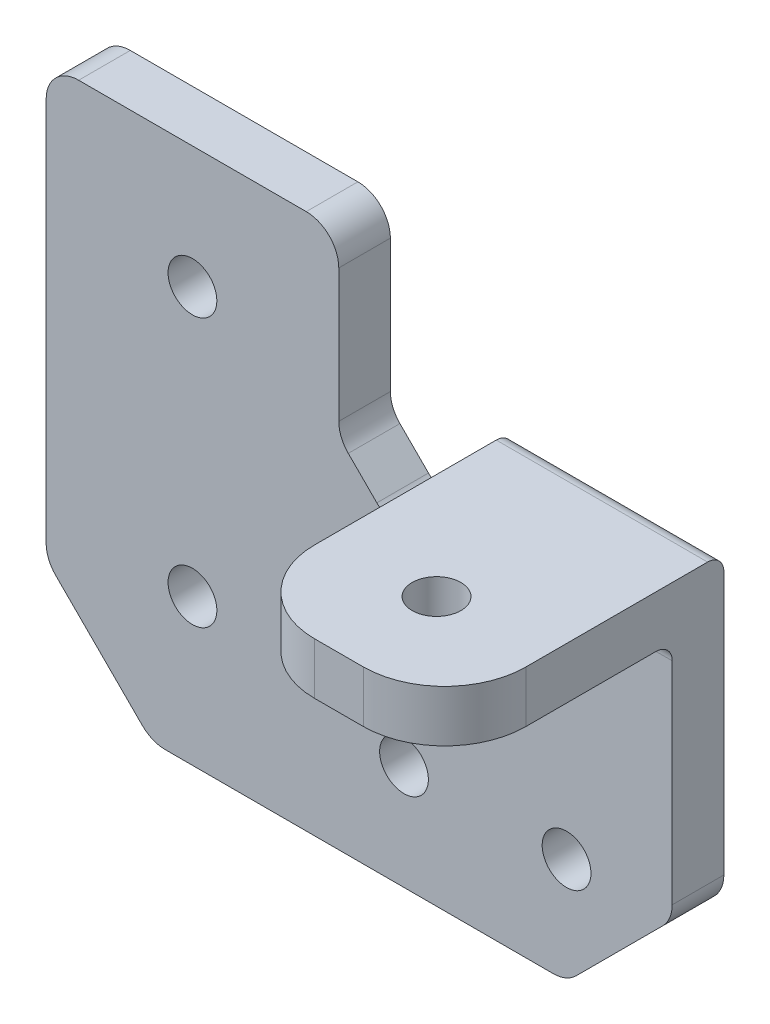
from build123d import *

# Parameters (mm, degrees)
SKETCH1_R               = 6.5
SKETCH1_R_2             = 1.5
BOSS_EXTRUDE1_DEPTH     = 3.175
SKETCH2_W               = 13
SKETCH2_H               = 3.175
BOSS_EXTRUDE2_DEPTH     = 14
SKETCH3_R               = 1.5
CUT_EXTRUDE1_DEPTH      = 18
FILLET1_R               = 5
BOSS_EXTRUDE3_START     = -3.175
BOSS_EXTRUDE3_OUTLINE_R = 1.5
BOSS_EXTRUDE3_DEPTH     = 3.175
FILLET3_R               = 1
BOSS_EXTRUDE4_START     = -3.175
BOSS_EXTRUDE4_DEPTH     = 3.175
SKETCH6_R               = 1.5
CUT_EXTRUDE2_DEPTH      = 3.175
CHAMFER1_SIZE           = 4
FILLET4_R               = 2
CUT_EXTRUDE3_DEPTH      = 10
FILLET5_R               = 2
SKETCH8_R               = 1.5
BOSS_EXTRUDE5_DEPTH     = 3.175
CHAMFER2_SIZE           = 4
FILLET6_R               = 2
SKETCH9_R               = 1.5
CUT_EXTRUDE4_DEPTH      = 10
SKETCH9_3_W             = 16.093211202
SKETCH9_3_H             = 15.71695658
SKETCH9_3_R             = 1.5
SKETCH9_3_W_2           = 4.964902022
SKETCH9_3_H_2           = 7.25050354
BOSS_EXTRUDE6_DEPTH     = 3.175
CHAMFER3_SIZE           = 6.5
FILLET7_R               = 2


# Read off the part's stored shape, not the designer's step: Boss-Extrude3
with BuildPart() as part:
    # Sketch1 → Boss-Extrude1 (new body)
    # profile 1 of 2: a face of its own
    with BuildSketch(Plane.XY):
        Circle(SKETCH1_R)
        Circle(SKETCH1_R_2, mode=Mode.SUBTRACT)
    # profile 2 of 2: a face of its own
    with BuildSketch(Plane.XY):
        with BuildLine():
            Line((-6.5, 18), (-6.5, 0))
            ThreePointArc((-6.5, 0), (0, 6.5), (6.5, 0))
            Line((6.5, 0), (6.5, 18))
            Line((6.5, 18), (-6.5, 18))
        make_face()
    extrude(amount=BOSS_EXTRUDE1_DEPTH)

    # Sketch2 → Boss-Extrude2 (add)
    with BuildSketch(Plane.XY.offset(3.175)):
        with Locations((0, 16.4125)):
            Rectangle(SKETCH2_W, SKETCH2_H)
    extrude(amount=BOSS_EXTRUDE2_DEPTH)

    # Sketch3 → Cut-Extrude1 (cut)
    with BuildSketch(Plane(origin=(0, 18, 0), x_dir=(1, 0, 0), z_dir=(0, 1, 0))):
        with Locations(Location((0, -11.175, 0), (0, 0, 270))):
            Circle(SKETCH3_R)
    extrude(amount=-CUT_EXTRUDE1_DEPTH, mode=Mode.SUBTRACT)

    # Fillet1
    fillet1_edges = [part.edges().sort_by_distance(p)[0] for p in [
        (-6.5, 16.4125, 17.175),
        (6.5, 16.4125, 17.175),
    ]]
    fillet(fillet1_edges, radius=FILLET1_R)

    # Boss-Extrude3 outline → Boss-Extrude3 (add)
    with BuildSketch(Plane(origin=(0, 0, 0), x_dir=(-1, 0, 0), z_dir=(0, 0, -1)).offset(BOSS_EXTRUDE3_START)):
        with BuildLine():
            ThreePointArc((6.5, 0), (4.596194078, -4.596194078), (0, -6.5))
            Line((0, -6.5), (10, -6.5))
            ThreePointArc((10, -6.5), (16.239069091, 1.823188658), (6.5, 5.477225575))
            Line((6.5, 5.477225575), (6.5, 0))
        make_face()
        with Locations((10, 0)):
            Circle(BOSS_EXTRUDE3_OUTLINE_R, mode=Mode.SUBTRACT)
    extrude(amount=BOSS_EXTRUDE3_DEPTH)

    # Fillet3
    fillet3_edges = [part.edges().sort_by_distance(p)[0] for p in [
        (0, 14.825, 3.175),
        (0, 18, 0),
    ]]
    fillet(fillet3_edges, radius=FILLET3_R)

    # Sketch5 → Boss-Extrude4 (add)
    with BuildSketch(Plane(origin=(0, 0, 0), x_dir=(-1, 0, 0), z_dir=(0, 0, -1)).offset(BOSS_EXTRUDE4_START)):
        with BuildLine():
            Line((32.012922913, -6.5), (32.012922913, 11.5))
            Line((32.012922913, 11.5), (6.5, 11.5))
            Line((6.5, 11.5), (6.5, 5.477225575))
            ThreePointArc((6.5, 5.477225575), (16.239069091, 1.823188658), (10, -6.5))
            Line((10, -6.5), (32.012922913, -6.5))
        make_face()
    extrude(amount=BOSS_EXTRUDE4_DEPTH)

    # Sketch6 → Cut-Extrude2 (cut)
    with BuildSketch(Plane(origin=(0, 0, 0), x_dir=(-1, 0, 0), z_dir=(0, 0, -1))):
        with Locations((18.012922913, -2.5)):
            Circle(SKETCH6_R)
        with Locations((28.012922913, -2.5)):
            Circle(SKETCH6_R)
        with Locations((18.012922913, 7.5)):
            Circle(SKETCH6_R)
        with Locations((28.012922913, 7.5)):
            Circle(SKETCH6_R)
        with Locations((23.012922913, 2.5)):
            Circle(SKETCH6_R)
    extrude(amount=-CUT_EXTRUDE2_DEPTH, mode=Mode.SUBTRACT)

    # Chamfer1
    # the kernel refuses this chamfer: 4 mm, written as the material it adds along each edge
    with BuildSketch(Plane(origin=(-6.5, 11.5, 3.175), x_dir=(0.027495876610586053, 0.9996219169112968, 0), z_dir=(0, 0, -1))) as chamfer1_piece_1:
        Polygon((CHAMFER1_SIZE * 0.999621916911, -CHAMFER1_SIZE * 0.0274958766106), (-CHAMFER1_SIZE * 0.0274958766106, -CHAMFER1_SIZE * 0.999621916911), (0, 0), align=None)
    extrude(amount=3.175)

    # Fillet4
    fillet4_edges = [part.edges().sort_by_distance(p)[0] for p in [
        (-32.012922913, 11.5, 1.5875),
        (-32.012922913, -6.5, 1.5875),
    ]]
    fillet(fillet4_edges, radius=FILLET4_R)

    # Sketch7 → Cut-Extrude3 (cut)
    with BuildSketch(Plane(origin=(0, 0, 0), x_dir=(-1, 0, 0), z_dir=(0, 0, -1))):
        Polygon((-6.5, 0), (0, -6.5), (-6.5, -6.5), align=None)
    extrude(amount=-CUT_EXTRUDE3_DEPTH, mode=Mode.SUBTRACT)

    # Fillet5
    fillet5_edges = [part.edges().sort_by_distance(p)[0] for p in [
        (6.5, 0, 1.5875),
        (-10.5, 11.5, 1.5875),
        (-6.5, 15.5, 1.5875),
        (0, -6.5, 1.5875),
    ]]
    fillet(fillet5_edges, radius=FILLET5_R)

    # Sketch8 → Boss-Extrude5 (add)
    # profile 1 of 4: a face of its own
    with BuildSketch(Plane(origin=(0, 0, 0), x_dir=(-1, 0, 0), z_dir=(0, 0, -1))):
        with BuildLine():
            Line((14.012922913, 11.5), (14.012922913, -6.5))
            Line((14.012922913, -6.5), (30.012922913, -6.5))
            ThreePointArc((30.012922913, -6.5), (31.427136475, -5.914213562), (32.012922913, -4.5))
            Line((32.012922913, -4.5), (32.012922913, 9.5))
            ThreePointArc((32.012922913, 9.5), (31.427136475, 10.914213562), (30.012922913, 11.5))
            Line((30.012922913, 11.5), (14.012922913, 11.5))
        make_face()
        with Locations((18.012922913, -2.5)):
            Circle(SKETCH8_R, mode=Mode.SUBTRACT)
        with Locations((18.012922913, 7.5)):
            Circle(SKETCH8_R, mode=Mode.SUBTRACT)
        with Locations((23.012922913, 2.5)):
            Circle(SKETCH8_R, mode=Mode.SUBTRACT)
        with Locations((28.012922913, -2.5)):
            Circle(SKETCH8_R, mode=Mode.SUBTRACT)
        with Locations((28.012922913, 7.5)):
            Circle(SKETCH8_R, mode=Mode.SUBTRACT)
    # profile 2 of 4: a face of its own
    with BuildSketch(Plane(origin=(0, 0, 0), x_dir=(-1, 0, 0), z_dir=(0, 0, -1))):
        Polygon((14.012922913, 26.5), (14.012922913, 11.5), (30.012922913, 11.5), (32.012922913, 11.5), (32.012922913, 26.5), align=None)
    # profile 3 of 4: a face of its own
    with BuildSketch(Plane(origin=(0, 0, 0), x_dir=(-1, 0, 0), z_dir=(0, 0, -1))):
        with BuildLine():
            Line((32.012922913, 11.5), (30.012922913, 11.5))
            ThreePointArc((30.012922913, 11.5), (31.427136475, 10.914213562), (32.012922913, 9.5))
            Line((32.012922913, 9.5), (32.012922913, 11.5))
        make_face()
    # profile 4 of 4: a face of its own
    with BuildSketch(Plane(origin=(0, 0, 0), x_dir=(-1, 0, 0), z_dir=(0, 0, -1))):
        with BuildLine():
            ThreePointArc((32.012922913, -4.5), (31.427136475, -5.914213562), (30.012922913, -6.5))
            Line((30.012922913, -6.5), (32.012922913, -6.5))
            Line((32.012922913, -6.5), (32.012922913, -4.5))
        make_face()
    extrude(amount=-BOSS_EXTRUDE5_DEPTH)

    # Chamfer2
    # the kernel refuses this chamfer: 4 mm, written as the material it adds along each edge
    with BuildSketch(Plane(origin=(-14.012922913, 11.5, 0), x_dir=(-0.027495876610586053, 0.9996219169112968, 0), z_dir=(0, 0, 1))) as chamfer2_piece_1:
        Polygon((CHAMFER2_SIZE * 0.999621916911, -CHAMFER2_SIZE * 0.0274958766106), (-CHAMFER2_SIZE * 0.0274958766106, -CHAMFER2_SIZE * 0.999621916911), (0, 0), align=None)
    extrude(amount=3.175)

    # Fillet6
    fillet6_edges = [part.edges().sort_by_distance(p)[0] for p in [
        (-32.012922913, 26.5, 1.5875),
        (-14.012922913, 26.5, 1.5875),
        (-14.012922913, 15.5, 1.5875),
        (-10.298499236, 11.785576323, 1.5875),
    ]]
    fillet(fillet6_edges, radius=FILLET6_R)

    # Sketch9 → Cut-Extrude4 (cut)
    with BuildSketch(Plane(origin=(0, 0, 0), x_dir=(-1, 0, 0), z_dir=(0, 0, -1))):
        with Locations((23.012922913, 19)):
            Circle(SKETCH9_R)
    extrude(amount=-CUT_EXTRUDE4_DEPTH, mode=Mode.SUBTRACT)

    # Sketch9<3> → Boss-Extrude6 (add)
    # profile 1 of 5: a face of its own
    with BuildSketch(Plane(origin=(0, 0, 0), x_dir=(-1, 0, 0), z_dir=(0, 0, -1))):
        with Locations((23.012922913, 2.5)):
            Rectangle(SKETCH9_3_W, SKETCH9_3_H)
        with Locations((28.012922913, -2.5)):
            Circle(SKETCH9_3_R, mode=Mode.SUBTRACT)
        with Locations((18.012922913, 7.5)):
            Circle(SKETCH9_3_R, mode=Mode.SUBTRACT)
        with Locations((18.012922913, -2.5)):
            Circle(SKETCH9_3_R, mode=Mode.SUBTRACT)
        with Locations((28.012922913, 7.5)):
            Circle(SKETCH9_3_R, mode=Mode.SUBTRACT)
        with Locations((23.012922913, 2.5)):
            Rectangle(SKETCH9_3_W_2, SKETCH9_3_H_2, mode=Mode.SUBTRACT)
    # profile 2 of 5: a face of its own
    with BuildSketch(Plane(origin=(0, 0, 0), x_dir=(-1, 0, 0), z_dir=(0, 0, -1))):
        with Locations((28.012922913, -2.5)):
            Circle(SKETCH9_3_R)
    # profile 3 of 5: a face of its own
    with BuildSketch(Plane(origin=(0, 0, 0), x_dir=(-1, 0, 0), z_dir=(0, 0, -1))):
        with Locations((28.012922913, 7.5)):
            Circle(SKETCH9_3_R)
    # profile 4 of 5: a face of its own
    with BuildSketch(Plane(origin=(0, 0, 0), x_dir=(-1, 0, 0), z_dir=(0, 0, -1))):
        with Locations((18.012922913, 7.5)):
            Circle(SKETCH9_3_R)
    # profile 5 of 5: a face of its own
    with BuildSketch(Plane(origin=(0, 0, 0), x_dir=(-1, 0, 0), z_dir=(0, 0, -1))):
        with Locations((18.012922913, -2.5)):
            Circle(SKETCH9_3_R)
    extrude(amount=-BOSS_EXTRUDE6_DEPTH)

    # Chamfer3
    chamfer3_edges = [part.edges().sort_by_distance(p)[0] for p in [
        (-32.012922913, -6.5, 1.5875),
    ]]
    chamfer(chamfer3_edges, length=CHAMFER3_SIZE)

    # Fillet7
    fillet7_edges = [part.edges().sort_by_distance(p)[0] for p in [
        (-25.512922913, -6.5, 1.5875),
        (-32.012922913, 0, 1.5875),
    ]]
    fillet(fillet7_edges, radius=FILLET7_R)


solid = part.part
